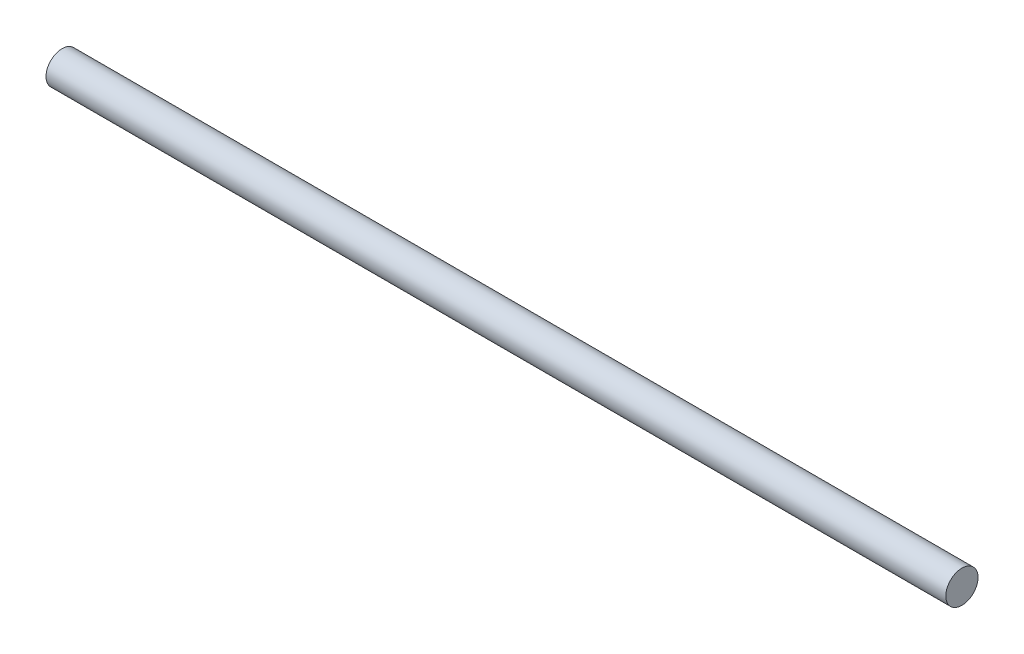
from build123d import *

# Parameters (mm, degrees)
SKETCH2_W = 221.522352046
SKETCH2_H = 3.96875


with BuildPart() as part:
    # Sketch2 → Revolve1 (revolve)
    with BuildSketch(Plane.XY):
        with Locations((110.761176023, 1.984375)):
            Rectangle(SKETCH2_W, SKETCH2_H)
    revolve(axis=Axis((0, 0, 0), (1, 0, 0)))


solid = part.part
